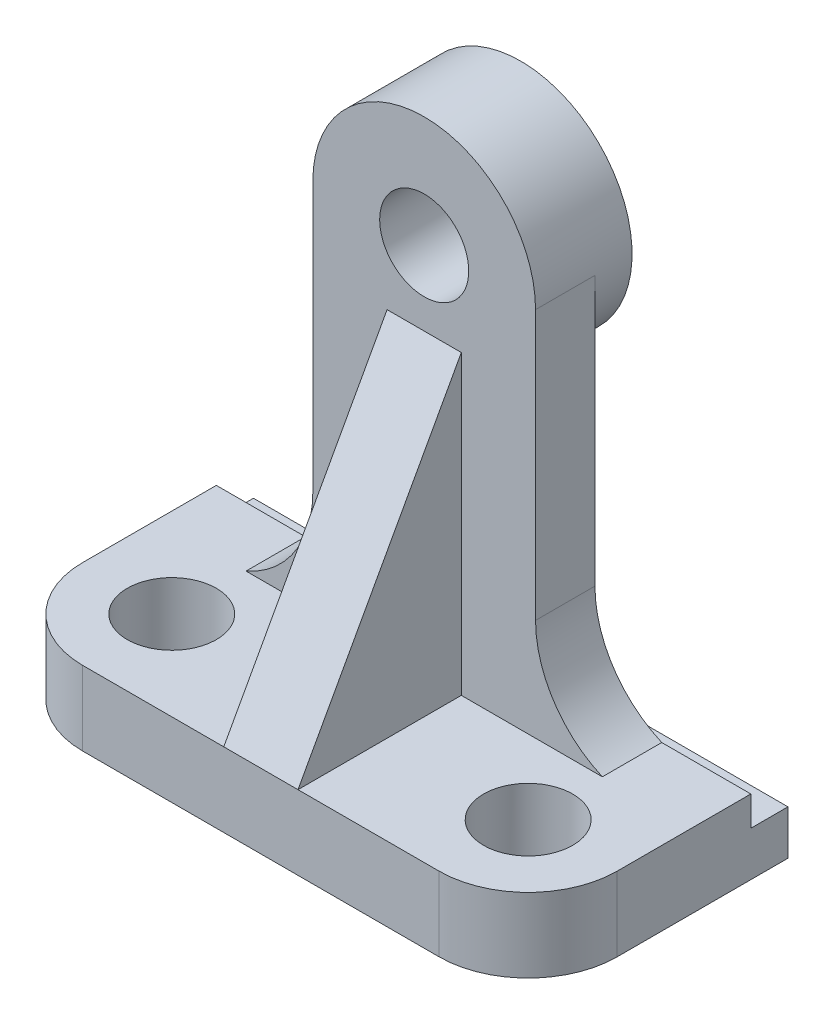
from build123d import *
from build123d.topology import SkipClean

# Parameters (mm, degrees)
BOSS_EXTRUDE1_DEPTH = 10
SKETCH3_W           = 5
SKETCH3_H           = 4
CUT_EXTRUDE1_DEPTH  = 74
BOSS_EXTRUDE2_DEPTH = 8
BOSS_EXTRUDE3_START = 5
SKETCH5_R           = 15
BOSS_EXTRUDE3_DEPTH = 5
SKETCH6_R           = 6
CUT_EXTRUDE2_DEPTH  = 13
RIB1_START          = -5
RIB1_DEPTH          = 10
SKETCH8_R           = 6
CUT_EXTRUDE4_DEPTH  = 11


# Read off the part's stored shape, not the designer's step: Rib1
with BuildPart() as part:
    # Sketch1 → Boss-Extrude1 (new body)
    with BuildSketch(Plane(origin=(0, 0, 0), x_dir=(1, 0, 0), z_dir=(0, 1, 0))):
        with BuildLine():
            Line((-36, 17.5), (36, 17.5))
            Line((36, 17.5), (36, -5.5))
            ThreePointArc((36, -5.5), (32.485281374, -13.985281374), (24, -17.5))
            Line((24, -17.5), (-24, -17.5))
            ThreePointArc((-24, -17.5), (-32.485281374, -13.985281374), (-36, -5.5))
            Line((-36, -5.5), (-36, 17.5))
        make_face()
    extrude(amount=BOSS_EXTRUDE1_DEPTH)

    # Sketch3 → Cut-Extrude1 (cut)
    with BuildSketch(Plane.ZY.offset(36)):
        with Locations((-15, 8)):
            Rectangle(SKETCH3_W, SKETCH3_H)
    extrude(amount=-CUT_EXTRUDE1_DEPTH, mode=Mode.SUBTRACT)

    # Sketch4 → Boss-Extrude2 (add)
    with BuildSketch(Plane(origin=(0, 0, -12.5), x_dir=(-1, 0, 0), z_dir=(0, 0, -1))):
        with BuildLine():
            Line((15, 60), (15, 23.747727085))
            ThreePointArc((15, 23.747727085), (17.450099602, 15.531888722), (24, 10))
            Line((24, 10), (-24, 10))
            ThreePointArc((-24, 10), (-17.450099602, 15.531888722), (-15, 23.747727085))
            Line((-15, 23.747727085), (-15, 60))
            ThreePointArc((-15, 60), (0, 75), (15, 60))
        make_face()
    extrude(amount=-BOSS_EXTRUDE2_DEPTH)

    # Sketch5 → Boss-Extrude3 (add)
    with SkipClean():  # the faces are left unmerged after this step: merging them gives an invalid solid
        with BuildSketch(Plane(origin=(0, 0, -12.5), x_dir=(-1, 0, 0), z_dir=(0, 0, -1)).offset(BOSS_EXTRUDE3_START)):
            with Locations((0, 60)):
                Circle(SKETCH5_R)
        extrude(amount=-BOSS_EXTRUDE3_DEPTH)

    # Sketch6 → Cut-Extrude2 (cut)
    with SkipClean():  # the faces are left unmerged after this step: merging them gives an invalid solid
        with BuildSketch(Plane(origin=(0, 0, -17.5), x_dir=(-1, 0, 0), z_dir=(0, 0, -1))):
            with Locations((0, 60)):
                Circle(SKETCH6_R)
        extrude(amount=-CUT_EXTRUDE2_DEPTH, mode=Mode.SUBTRACT)

    # Rib1 outline → Rib1 (add)
    with SkipClean():  # the faces are left unmerged after this step: merging them gives an invalid solid
        with BuildSketch(Plane(origin=(0, 0, 0), x_dir=(0, 0, -1), z_dir=(1, 0, 0)).offset(RIB1_START)):
            Polygon((4.5, 50), (-17.5, 10), (4.5, 10), align=None)
        extrude(amount=RIB1_DEPTH)

    # Sketch8 → Cut-Extrude4 (cut)
    with SkipClean():  # the faces are left unmerged after this step: merging them gives an invalid solid
        with BuildSketch(Plane(origin=(0, 10, 0), x_dir=(1, 0, 0), z_dir=(0, 1, 0))):
            with Locations(Location((24, -5.5, 0), (0, 0, 270))):
                Circle(SKETCH8_R)
            with Locations(Location((-24, -5.5, 0), (0, 0, 90))):
                Circle(SKETCH8_R)
        extrude(amount=-CUT_EXTRUDE4_DEPTH, mode=Mode.SUBTRACT)


solid = part.part
